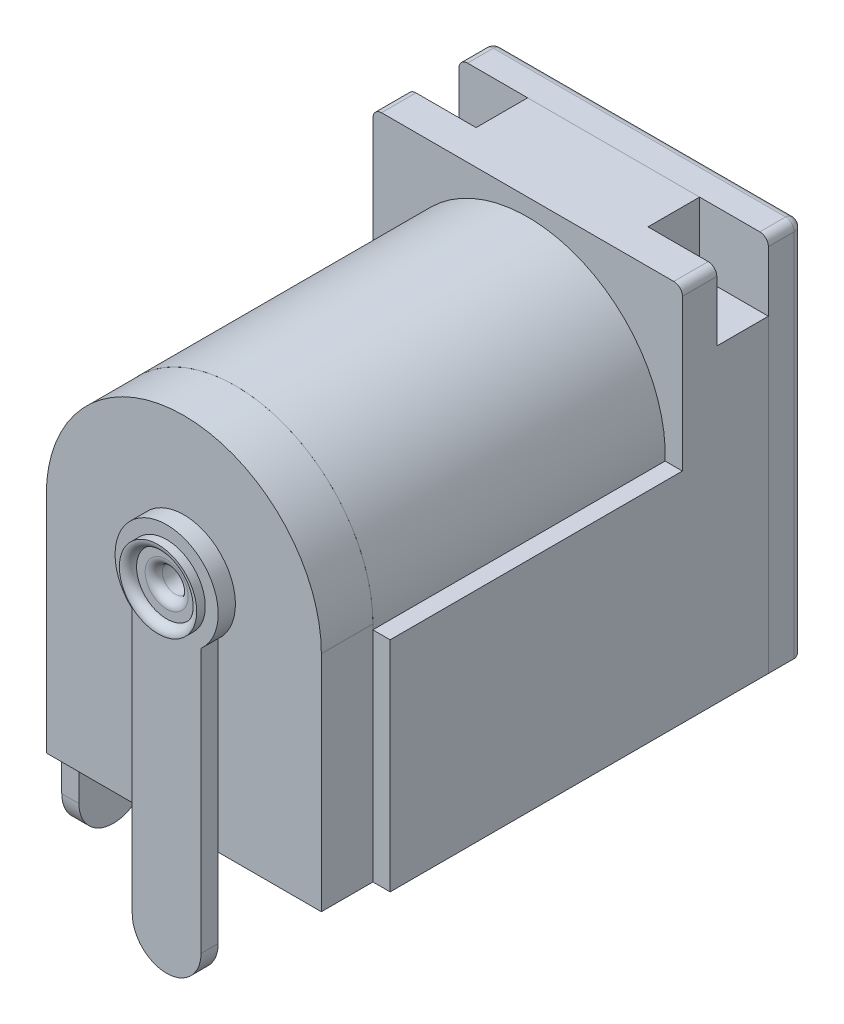
from build123d import *

# Parameters (mm, degrees)
SKETCH1_W              = 9
SKETCH1_H              = 6.35
BOSS_EXTRUDE1_DEPTH    = 12
SKETCH2_W              = 9
SKETCH2_H              = 11
BOSS_EXTRUDE2_DEPTH    = 3.5
SKETCH4_R              = 4
BOSS_EXTRUDE3_DEPTH    = 12
SKETCH5_W              = 2
SKETCH5_H              = 2
CUT_EXTRUDE1_DEPTH     = 0.75
FILLET1_R              = 0.25
CUT_EXTRUDE2_REACH     = 17.016
SKETCH6_R              = 3.25
SKETCH7_W              = 8
SKETCH7_H              = 4
CUT_EXTRUDE3_DEPTH     = 11
BOSS_EXTRUDE5_DEPTH    = 1.5
SPLIT1_SURFACE_1_BACK  = 20.602
SPLIT1_SURFACE_1_DEPTH = 41.204
SPLIT1_SURFACE_2_BACK  = 20.602
SPLIT1_SURFACE_2_DEPTH = 41.204
SKETCH10_R             = 1.5
CUT_EXTRUDE4_DEPTH     = 17.239785251
SKETCH11_R             = 1.5
BOSS_EXTRUDE6_DEPTH    = 2
SKETCH12_R             = 0.75
BOSS_EXTRUDE7_DEPTH    = 11
FILLET2_R              = 0.7
BOSS_EXTRUDE8_DEPTH    = 0.5
SKETCH14_W             = 0.5
SKETCH14_H             = 0.5
CUT_EXTRUDE5_DEPTH     = 2
EXTRUDE_THIN1_DEPTH    = 2
BOSS_EXTRUDE9_DEPTH    = 0.5
BOSS_EXTRUDE10_DEPTH   = 0.5
EXTRUDE_THIN2_DEPTH    = 2
SKETCH21_R             = 1.125
SKETCH21_R_2           = 0.875
EXTRUDE_THIN3_DEPTH    = 0.25
SKETCH22_R             = 0.375
CUT_EXTRUDE6_DEPTH     = 3
FILLET3_R              = 0.25


with BuildPart() as part:
    # Sketch1 → Boss-Extrude1 (new body)
    with BuildSketch(Plane.XY):
        Rectangle(SKETCH1_W, SKETCH1_H)
    extrude(amount=BOSS_EXTRUDE1_DEPTH)

    # Sketch2 → Boss-Extrude2 (add)
    with BuildSketch(Plane(origin=(0, 0, 0), x_dir=(-1, 0, 0), z_dir=(0, 0, -1))):
        with Locations((0, 2.325)):
            Rectangle(SKETCH2_W, SKETCH2_H)
    extrude(amount=-BOSS_EXTRUDE2_DEPTH)

    # Sketch4 → Boss-Extrude3 (add)
    with BuildSketch(Plane(origin=(0, 0, 0), x_dir=(-1, 0, 0), z_dir=(0, 0, -1))):
        with Locations((0, 3.325)):
            Circle(SKETCH4_R)
    extrude(amount=-BOSS_EXTRUDE3_DEPTH)

    # Sketch5 → Cut-Extrude1 (cut, symmetric)
    with BuildSketch(Plane.XY.offset(1.75)):
        with Locations((-3.5, 6.825)):
            Rectangle(SKETCH5_W, SKETCH5_H)
        with Locations((3.5, 6.825)):
            Rectangle(SKETCH5_W, SKETCH5_H)
    extrude(amount=CUT_EXTRUDE1_DEPTH, both=True, mode=Mode.SUBTRACT)

    # Fillet1
    fillet1_edges = [part.edges().sort_by_distance(p)[0] for p in [
        (0, 7.825, 0),
        (-4.5, 7.825, 3),
        (4.5, 7.825, 3),
        (-4.5, 7.825, 0.5),
        (4.5, 7.825, 0.5),
        (4.5, 2.325, 0),
        (0, -3.175, 0),
        (-4.5, 2.325, 0),
    ]]
    fillet(fillet1_edges, radius=FILLET1_R)

    # Sketch6 → Cut-Extrude2 (cut, up to next)
    with BuildSketch(Plane(origin=(0, 0, 0), x_dir=(-1, 0, 0), z_dir=(0, 0, -1)), mode=Mode.PRIVATE) as cut_extrude2_sk1:
        with Locations((0, 3.325)):
            Circle(SKETCH6_R)
    cut_extrude2_tool1 = extrude(cut_extrude2_sk1.sketch, amount=-CUT_EXTRUDE2_REACH, mode=Mode.PRIVATE) & part.part
    add(cut_extrude2_tool1.solids().sort_by_distance((0, 3.325, 0))[0], mode=Mode.SUBTRACT)

    # Sketch7 → Cut-Extrude3 (cut)
    with BuildSketch(Plane.XY.offset(12)):
        with Locations((0, -0.675)):
            Rectangle(SKETCH7_W, SKETCH7_H)
    extrude(amount=-CUT_EXTRUDE3_DEPTH, mode=Mode.SUBTRACT)


with BuildPart() as body_2:
    # Sketch8 → Boss-Extrude5 (new body)
    with BuildSketch(Plane.XY.offset(12)):
        with BuildLine():
            Line((-4, 3.325), (-4, -3.175))
            Line((-4, -3.175), (4, -3.175))
            Line((4, -3.175), (4, 3.325))
            ThreePointArc((4, 3.325), (0, 7.325), (-4, 3.325))
        make_face()
    extrude(amount=BOSS_EXTRUDE5_DEPTH)

    # Sketch10 → Cut-Extrude4 (cut, through all)
    with BuildSketch(Plane.XY.offset(13.5)):
        with Locations((0, 3.325)):
            Circle(SKETCH10_R)
    extrude(amount=-CUT_EXTRUDE4_DEPTH, mode=Mode.SUBTRACT)


with BuildPart() as body_3:
    # Split1: the piece behind the surface
    add(part.part)
    # Split1 surface: a surface, the sketch's curves swept straight by 41.204 mm
    with BuildLine(Plane(origin=(0, 7.825, 0), x_dir=(1, 0, 0), z_dir=(0, 1, 0)).offset(-SPLIT1_SURFACE_1_BACK), mode=Mode.PRIVATE) as split1_surface_1_path:
        Line((-5, -1), (5, -1))
    split1_surface_1 = Shell.extrude(split1_surface_1_path.wire(), (0 * SPLIT1_SURFACE_1_DEPTH, 1 * SPLIT1_SURFACE_1_DEPTH, 0 * SPLIT1_SURFACE_1_DEPTH))
    split(bisect_by=split1_surface_1, keep=Keep.BOTTOM)

    # Sketch14 → Cut-Extrude5 (cut)
    with BuildSketch(Plane.XY.offset(12)):
        with Locations((-4.25, 0.925)):
            Rectangle(SKETCH14_W, SKETCH14_H)
    extrude(amount=-CUT_EXTRUDE5_DEPTH, mode=Mode.SUBTRACT)


with BuildPart() as part_1:
    add(part.part)

    # Split1: split by a surface, the side it looks to stays
    # Split1 surface: a surface, the sketch's curves swept straight by 41.204 mm
    with BuildLine(Plane(origin=(0, 7.825, 0), x_dir=(1, 0, 0), z_dir=(0, 1, 0)).offset(-SPLIT1_SURFACE_2_BACK), mode=Mode.PRIVATE) as split1_surface_2_path:
        Line((-5, -1), (5, -1))
    split1_surface_2 = Shell.extrude(split1_surface_2_path.wire(), (0 * SPLIT1_SURFACE_2_DEPTH, 1 * SPLIT1_SURFACE_2_DEPTH, 0 * SPLIT1_SURFACE_2_DEPTH))
    split(bisect_by=split1_surface_2, keep=Keep.TOP)


with BuildPart() as body_4:
    # Sketch11 → Boss-Extrude6 (new body)
    with BuildSketch(Plane(origin=(0, 0, 12), x_dir=(-1, 0, 0), z_dir=(0, 0, -1))):
        with Locations((0, 3.325)):
            Circle(SKETCH11_R)
    extrude(amount=-BOSS_EXTRUDE6_DEPTH)

    # Sketch12 → Boss-Extrude7 (add)
    with BuildSketch(Plane(origin=(0, 0, 12), x_dir=(-1, 0, 0), z_dir=(0, 0, -1))):
        with Locations(Location((0, 3.325, 0), (0, 0, 180))):
            Circle(SKETCH12_R)
    extrude(amount=BOSS_EXTRUDE7_DEPTH)

    # Fillet2
    fillet2_edges = [body_4.edges().sort_by_distance(p)[0] for p in [
        (-0.75, 3.325, 1),
    ]]
    fillet(fillet2_edges, radius=FILLET2_R)

    # Sketch13 → Boss-Extrude8 (add)
    with BuildSketch(Plane.XY.offset(13.5)):
        with BuildLine():
            Line((-1, 2.206966011), (-1, -5.475))
            ThreePointArc((-1, -5.475), (0, -6.475), (1, -5.475))
            Line((1, -5.475), (1, 2.206966011))
            ThreePointArc((1, 2.206966011), (0, 1.825), (-1, 2.206966011))
        make_face()
    extrude(amount=BOSS_EXTRUDE8_DEPTH)

    # Sketch21 → Extrude-Thin3 (add)
    with BuildSketch(Plane.XY.offset(14)):
        with Locations((0, 3.325)):
            Circle(SKETCH21_R)
        with Locations((0, 3.325)):
            Circle(SKETCH21_R_2, mode=Mode.SUBTRACT)
    extrude(amount=EXTRUDE_THIN3_DEPTH)

    # Sketch22 → Cut-Extrude6 (cut)
    with BuildSketch(Plane.XY.offset(14)):
        with Locations((0, 3.325)):
            Circle(SKETCH22_R)
    extrude(amount=-CUT_EXTRUDE6_DEPTH, mode=Mode.SUBTRACT)

    # Fillet3
    fillet3_edges = [body_4.edges().sort_by_distance(p)[0] for p in [
        (-0.875, 3.325, 14.25),
        (-0.375, 3.325, 14),
    ]]
    fillet(fillet3_edges, radius=FILLET3_R - 0.0001)  # a hair under: the kernel refuses the full size


with BuildPart() as body_5:
    # Sketch15 → Extrude-Thin1 (new body)
    with BuildSketch(Plane.XY.offset(12)):
        with BuildLine():
            Line((-3.5, 0.675), (-4.5, 0.675))
            ThreePointArc((-4.5, 0.675), (-4.535355339, 0.660355339), (-4.55, 0.625))
            Line((-4.55, 0.625), (-4.55, -3.175))
            Line((-4.55, -3.175), (-5.05, -3.175))
            Line((-5.05, -3.175), (-5.05, 0.625))
            ThreePointArc((-5.05, 0.625), (-4.88890873, 1.01390873), (-4.5, 1.175))
            Line((-4.5, 1.175), (-3.5, 1.175))
            Line((-3.5, 1.175), (-3.5, 0.675))
        make_face()
    extrude(amount=-EXTRUDE_THIN1_DEPTH)

    # Sketch16 → Boss-Extrude9 (add)
    with BuildSketch(Plane.ZY.offset(5.05)):
        with BuildLine():
            Line((10, -3.175), (10, -5.475))
            ThreePointArc((10, -5.475), (11, -6.475), (12, -5.475))
            Line((12, -5.475), (12, -3.175))
            Line((12, -3.175), (10, -3.175))
        make_face()
    extrude(amount=-BOSS_EXTRUDE9_DEPTH)


with BuildPart() as body_6:
    # Sketch17 → Boss-Extrude10 (new body)
    with BuildSketch(Plane.XY.offset(7.5)):
        with BuildLine():
            Line((-1, -3.175), (-1, -5.475))
            ThreePointArc((-1, -5.475), (0, -6.475), (1, -5.475))
            Line((1, -5.475), (1, -3.175))
            Line((1, -3.175), (1, -1.675))
            Line((1, -1.675), (-1, -1.675))
            Line((-1, -1.675), (-1, -3.175))
        make_face()
    extrude(amount=-BOSS_EXTRUDE10_DEPTH)


with BuildPart() as body_7:
    # Sketch18 → Extrude-Thin2 (new, symmetric)
    with BuildSketch(Plane(origin=(0, 0, 0), x_dir=(0, 0, -1), z_dir=(1, 0, 0))):
        with BuildLine():
            Line((-1, -2.675), (-1, -1.175))
            ThreePointArc((-1, -1.175), (-1.271271934, -0.314635345), (-1.986969785, 0.234538931))
            Line((-1.986969785, 0.234538931), (-5.745740268, 1.602619504))
            ThreePointArc((-5.745740268, 1.602619504), (-6.51924275, 1.670292203), (-7.222951898, 1.342147238))
            Line((-7.222951898, 1.342147238), (-6.901558093, 0.959125016))
            ThreePointArc((-6.901558093, 0.959125016), (-6.432418661, 1.177888326), (-5.91675034, 1.132773194))
            Line((-5.91675034, 1.132773194), (-2.157979857, -0.235307379))
            ThreePointArc((-2.157979857, -0.235307379), (-1.680847956, -0.601423564), (-1.5, -1.175))
            Line((-1.5, -1.175), (-1.5, -2.675))
            Line((-1.5, -2.675), (-1, -2.675))
        make_face()
    extrude(amount=EXTRUDE_THIN2_DEPTH, both=True)


solid = Compound([body_2.part, body_3.part, part_1.part, body_4.part, body_5.part, body_6.part, body_7.part])
